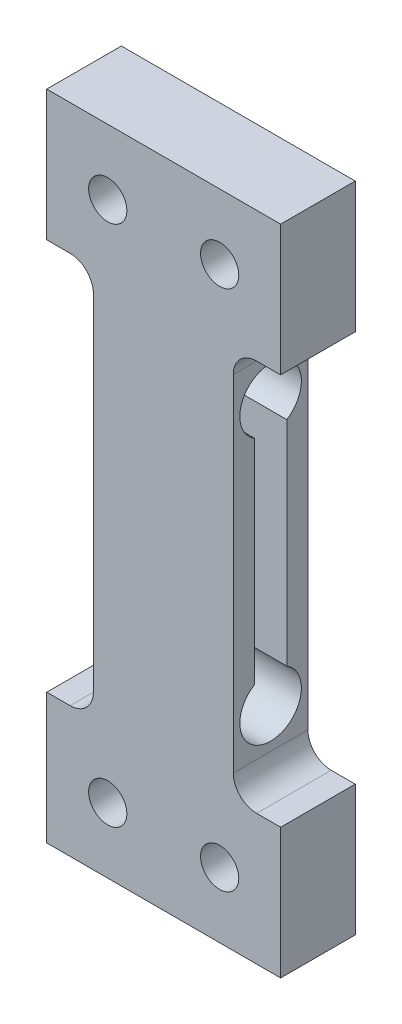
from build123d import *

# Parameters (mm, degrees)
SKETCH1_W                = 12.538434267
SKETCH1_H                = 35
BOSS_EXTRUDE1_DEPTH      = 4
SKETCH2_W                = 2.5
SKETCH2_H                = 21
CUT_EXTRUDE1_DEPTH       = 37.619666847
SKETCH3_W                = 2.538434267
SKETCH3_H                = 21
CUT_EXTRUDE2_DEPTH       = 37.619666847
CUT_EXTRUDE3_DEPTH       = 37.630181033
SKETCH5_W                = 7.5
SKETCH5_H                = 1.65
SKETCH6_W                = 7.5
SKETCH6_H                = 1.65
M2_5X0_45_TAPPED_HOLE1_D = 2.05
FILLET1_R                = 1.25


with BuildPart() as part:
    # Sketch1 → Boss-Extrude1 (new body)
    with BuildSketch(Plane.XY.offset(4)):
        with Locations((-3.730782867, 17.5)):
            Rectangle(SKETCH1_W, SKETCH1_H)
    extrude(amount=-BOSS_EXTRUDE1_DEPTH)

    # Sketch2 → Cut-Extrude1 (cut, through all)
    with BuildSketch(Plane(origin=(0, 0, 0), x_dir=(-1, 0, 0), z_dir=(0, 0, -1))):
        with Locations((8.75, 17.5)):
            Rectangle(SKETCH2_W, SKETCH2_H)
    extrude(amount=-CUT_EXTRUDE1_DEPTH, mode=Mode.SUBTRACT)

    # Sketch3 → Cut-Extrude2 (cut, through all)
    with BuildSketch(Plane(origin=(0, 0, 0), x_dir=(-1, 0, 0), z_dir=(0, 0, -1))):
        with Locations((-1.269217133, 17.5)):
            Rectangle(SKETCH3_W, SKETCH3_H)
    extrude(amount=-CUT_EXTRUDE2_DEPTH, mode=Mode.SUBTRACT)

    # Sketch4 → Cut-Extrude3 (cut, through all)
    with BuildSketch(Plane.ZY.offset(7.5)):
        with BuildLine():
            Line((2.855933763, 11.78563014), (2.855933763, 23.21436986))
            ThreePointArc((2.855933763, 23.21436986), (1.992824856, 22.975015601), (1.13183027, 23.221867319))
            Line((1.13183027, 23.221867319), (1.13183027, 11.778132681))
            ThreePointArc((1.13183027, 11.778132681), (1.992824856, 12.024984399), (2.855933763, 11.78563014))
        make_face()
    extrude(amount=-CUT_EXTRUDE3_DEPTH, mode=Mode.SUBTRACT)

    # Sketch5 → Cut-Revolve1 (revolve, cut)
    with BuildSketch(Plane(origin=(0, 0, 2), x_dir=(-1, 0, 0), z_dir=(0, 0, -1))):
        with Locations((3.75, 25.45)):
            Rectangle(SKETCH5_W, SKETCH5_H)
    revolve(axis=Axis((0, 24.625, 2), (-1, 0, 0)), mode=Mode.SUBTRACT)

    # Sketch6 → Cut-Revolve2 (revolve, cut)
    with BuildSketch(Plane(origin=(0, 0, 2), x_dir=(-1, 0, 0), z_dir=(0, 0, -1))):
        with Locations((3.75, 11.2)):
            Rectangle(SKETCH6_W, SKETCH6_H)
    revolve(axis=Axis((0, 10.375, 2), (-1, 0, 0)), mode=Mode.SUBTRACT)

    # M2.5x0.45 Tapped Hole1 (through all)
    with Locations(Plane.XY.offset(4)):
        with Locations((-0.730782866, 3.5), (-6.730782866, 3.5), (-0.730782866, 31.5), (-6.730782866, 31.5)):
            Hole(M2_5X0_45_TAPPED_HOLE1_D / 2)

    # Fillet1
    fillet1_edges = [part.edges().sort_by_distance(p)[0] for p in [
        (-7.5, 28, 2),
        (-7.5, 7, 2),
        (0, 28, 2),
        (0, 7, 2),
    ]]
    fillet(fillet1_edges, radius=FILLET1_R)


solid = part.part
